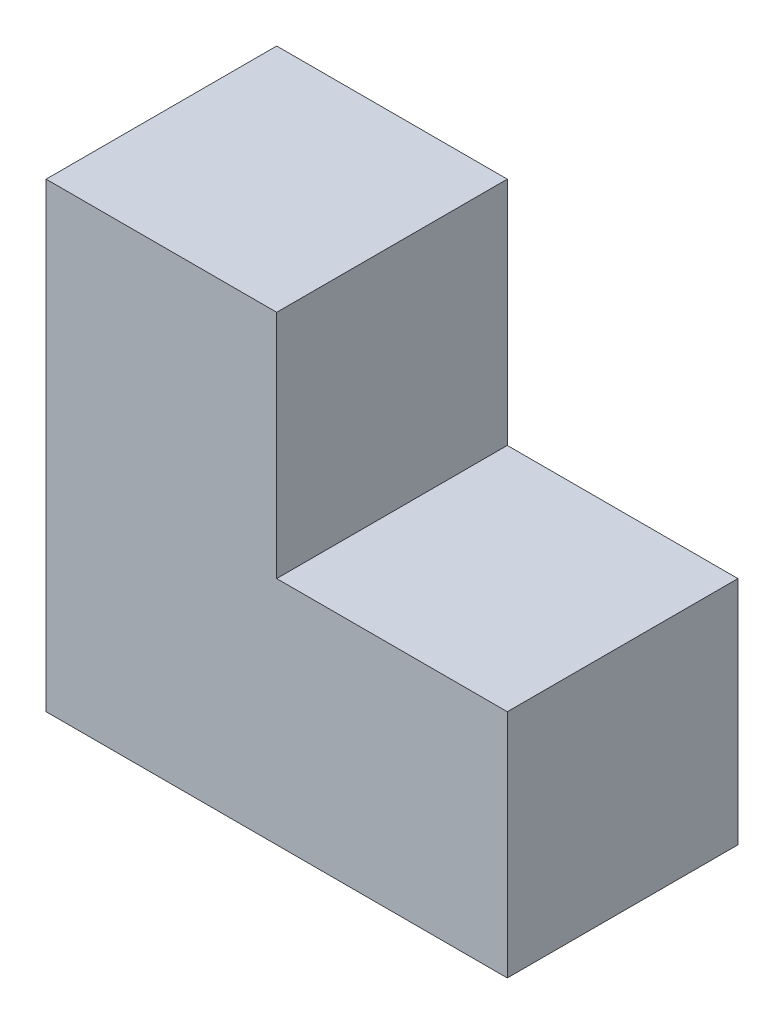
from build123d import *

# Parameters (mm, degrees)
EXTRUDE_1_DEPTH      = 15
EXTRUDE_1_DEPTH_BACK = 15


with BuildPart() as part:
    # 草圖1 → 擠出1 (new, two sides: drawn at the far end of the back side and taken through both)
    with BuildSketch(Plane.XY.offset(-EXTRUDE_1_DEPTH_BACK)):
        Polygon((0, 0), (60, 0), (60, 30), (30, 30), (30, 60), (0, 60), align=None)
    extrude(amount=EXTRUDE_1_DEPTH + EXTRUDE_1_DEPTH_BACK)


solid = part.part
